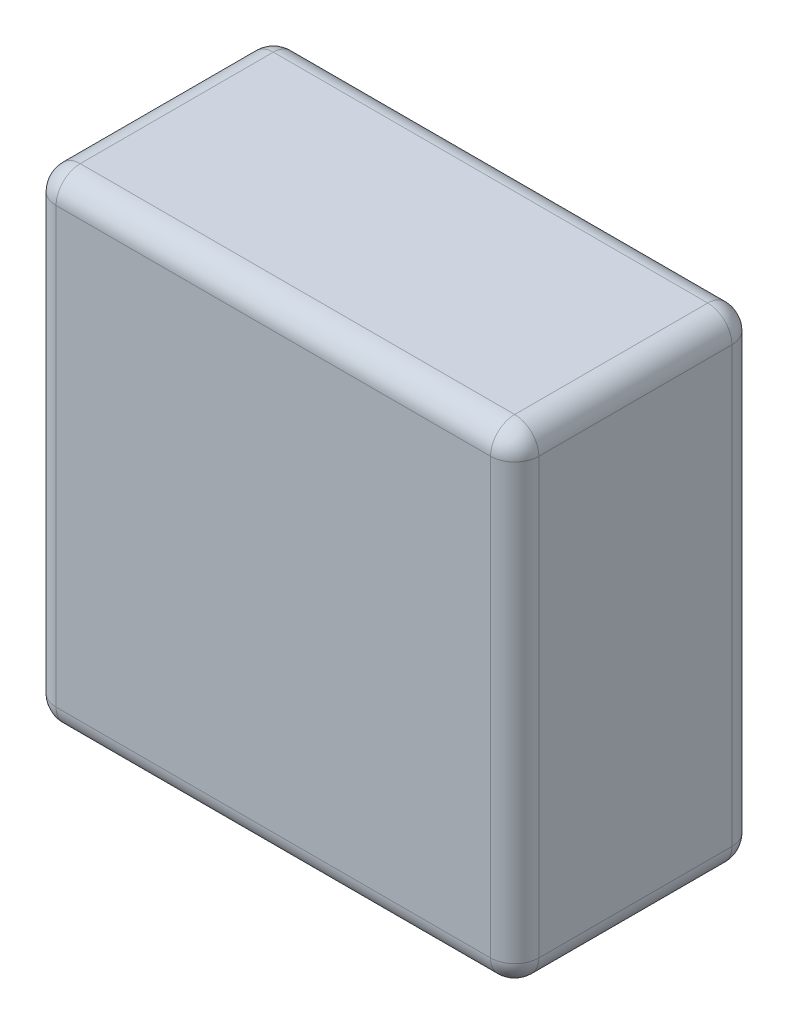
from build123d import *

# Parameters (mm, degrees)
ESQUISSE1_W        = 10
ESQUISSE1_H        = 10
BOSS_EXTRU_1_DEPTH = 5
CONG_1_R           = 0.5


with BuildPart() as part:
    # Esquisse1 → Boss.-Extru.1 (new body)
    with BuildSketch(Plane.XY):
        with Locations((5, -5)):
            Rectangle(ESQUISSE1_W, ESQUISSE1_H)
    extrude(amount=BOSS_EXTRU_1_DEPTH)

    # Congé1
    cong_1_edges = [part.edges().sort_by_distance(p)[0] for p in [
        (0, 0, 2.5),
        (0, -10, 2.5),
        (10, -10, 2.5),
        (10, 0, 2.5),
        (5, -10, 0),
        (10, -5, 0),
        (5, 0, 0),
        (0, -5, 0),
        (5, 0, 5),
        (10, -5, 5),
        (5, -10, 5),
        (0, -5, 5),
    ]]
    fillet(cong_1_edges, radius=CONG_1_R)


solid = part.part
